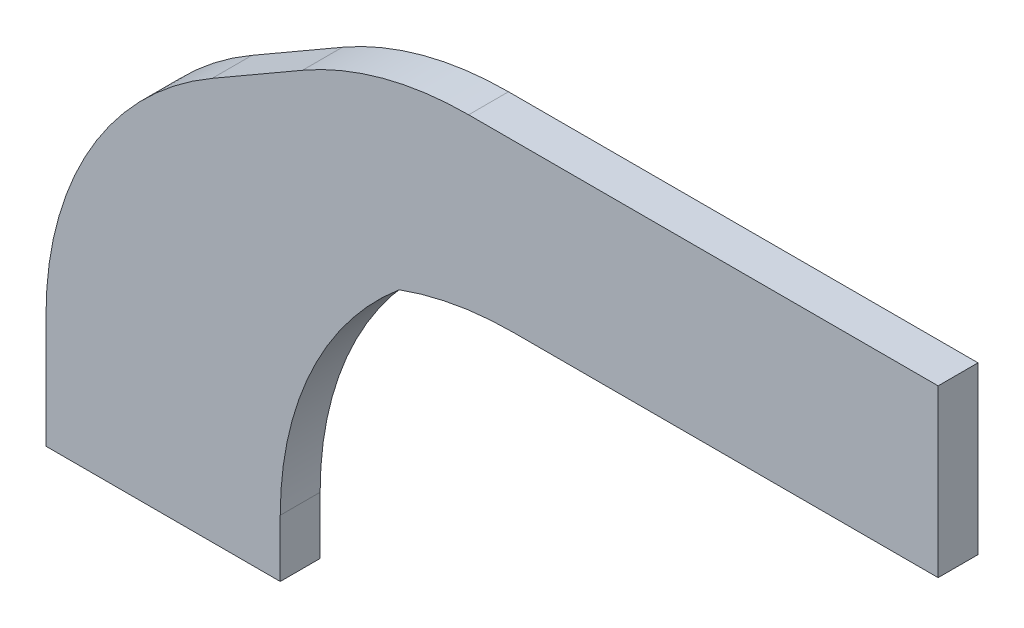
from build123d import *

# Parameters (mm, degrees)
BOSS_EXTRUDE1_DEPTH = 0.12
FILLET1_R           = 2


with BuildPart() as part:
    # Sketch1 → Boss-Extrude1 (new, symmetric)
    with BuildSketch(Plane.XY):
        Polygon((0, 0), (1.41, 0), (1.41, 1.5), (2.276025404, 2), (5.37, 2), (5.37, 3), (2.008076211, 3), (0, 1.840636659), align=None)
    extrude(amount=BOSS_EXTRUDE1_DEPTH, both=True)

    # Fillet1
    # the kernel refuses this fillet: 2 mm, written as the material it adds along each edge
    with BuildSketch(Plane(origin=(1.41, 1.5, -0.12), x_dir=(0.8660254037844385, 0.5000000000000003, 0), z_dir=(0, 0, 1))) as fillet1_piece_1:
        with BuildLine():
            CenterArc((FILLET1_R * 0.57735026919, -FILLET1_R), FILLET1_R, 90, 60)
            Line((-FILLET1_R * 0.288675134595, -FILLET1_R * 0.5), (0, 0))
            Line((0, 0), (FILLET1_R * 0.57735026919, 0))
        make_face()
    extrude(amount=0.24)
    with BuildSketch(Plane(origin=(2.276025404, 2, -0.12), x_dir=(1, 0, 0), z_dir=(0, 0, 1))) as fillet1_piece_2:
        with BuildLine():
            CenterArc((FILLET1_R * 0.267949192431, -FILLET1_R), FILLET1_R, 90, 30)
            Line((-FILLET1_R * 0.232050807569, -FILLET1_R * 0.133974596216), (0, 0))
            Line((0, 0), (FILLET1_R * 0.267949192431, 0))
        make_face()
    extrude(amount=0.24)
    # the kernel refuses this fillet: 2 mm, written as the material it takes off along each edge
    with BuildSketch(Plane(origin=(2.008076211, 3, 1.459745962), x_dir=(-0.8660254037844389, -0.4999999999999996, 0), z_dir=(0, 0, -1))) as fillet1_2_piece_1:
        with BuildLine():
            CenterArc((FILLET1_R * 0.267949192431, -FILLET1_R), FILLET1_R, 90, 30)
            Line((-FILLET1_R * 0.232050807569, -FILLET1_R * 0.133974596216), (0, 0))
            Line((0, 0), (FILLET1_R * 0.267949192431, 0))
        make_face()
    extrude(amount=2.919491924, mode=Mode.SUBTRACT)
    with BuildSketch(Plane(origin=(0, 1.840636659, 3.006751346), x_dir=(0, -1, 0), z_dir=(0, 0, -1))) as fillet1_2_piece_2:
        with BuildLine():
            CenterArc((FILLET1_R * 0.57735026919, -FILLET1_R), FILLET1_R, 90, 60)
            Line((-FILLET1_R * 0.288675134595, -FILLET1_R * 0.5), (0, 0))
            Line((0, 0), (FILLET1_R * 0.57735026919, 0))
        make_face()
    extrude(amount=6.013502692, mode=Mode.SUBTRACT)


solid = part.part
